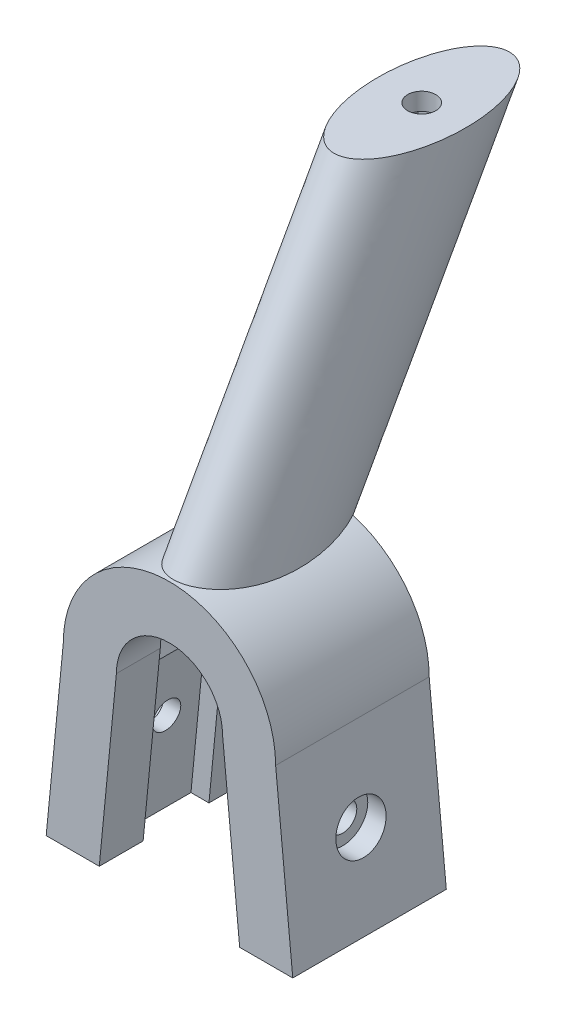
from build123d import *

# Parameters (mm, degrees)
BOSS_EXTRUDE1_DEPTH         = 3.75
BOLT_HOLE_REACH             = 26.729
SKETCH2_R                   = 1.6
BOLT_HOLE_DIRECTION_2_REACH = 26.729
BOSS_EXTRUDE2_START         = 5
BOSS_EXTRUDE2_DEPTH         = 5
CUT_EXTRUDE2_START          = 11
SKETCH4_R                   = 2.85
CUT_EXTRUDE2_DEPTH          = 3
SKETCH7_RX                  = 10
SKETCH7_RY                  = 5
SWEEP2_START                = 10.247926509
SWEEP2_DEPTH                = 2.568432868
SKETCH11_W                  = 7.251223943
SKETCH11_H                  = 3.177760732
CUT_EXTRUDE3_DEPTH          = 20
CUT_EXTRUDE5_START          = -2
CUT_EXTRUDE5_DEPTH          = 2.7
SKETCH13_R                  = 1.6
CUT_EXTRUDE6_DEPTH          = 2.7
CUT_EXTRUDE7_START          = -11
CUT_EXTRUDE7_DEPTH          = 10


# Read off the part's stored shape, not the designer's step: Sweep2
with BuildPart() as part:
    # Sketch1 → Boss-Extrude1 (new, symmetric)
    with BuildSketch(Plane.XY):
        with BuildLine():
            Line((-12.1, 0), (-14.051700625, -20))
            Line((-14.051700625, -20), (-10.051700625, -20))
            Line((-10.051700625, -20), (-8.425, -3.439385846))
            ThreePointArc((-8.425, -3.439385846), (0, 9.1), (8.425, -3.439385846))
            Line((8.425, -3.439385846), (10.051700625, -20))
            Line((10.051700625, -20), (14.051700625, -20))
            Line((14.051700625, -20), (12.1, 0))
            ThreePointArc((12.1, 0), (0, 12.1), (-12.1, 0))
        make_face()
    extrude(amount=BOSS_EXTRUDE1_DEPTH, both=True)

    # Bolt Hole: up to this plane
    bolt_hole_end = Plane(origin=(14.051700625, -20, 3.75), z_dir=(-0.995272319868323, -0.09712368044883128, 0))
    # Sketch2 → Bolt Hole (cut, up to the surface)
    with BuildSketch(Plane(origin=(0, 0, 0), x_dir=(0, 0, -1), z_dir=(1, 0, 0)), mode=Mode.PRIVATE) as bolt_hole_sk1:
        with Locations(Location((0, -10, 0), (0, 0, 90))):
            Circle(SKETCH2_R)
    bolt_hole_tool1 = split(extrude(bolt_hole_sk1.sketch, amount=BOLT_HOLE_REACH, mode=Mode.PRIVATE), bisect_by=bolt_hole_end, keep=Keep.BOTH, mode=Mode.PRIVATE)
    add(bolt_hole_tool1.solids().sort_by_distance((0, -10, 0))[0], mode=Mode.SUBTRACT)

    # Bolt Hole direction 2: up to this plane
    bolt_hole_direction_2_end = Plane(origin=(-12.1, 0, 3.75), z_dir=(0.995272319868323, -0.09712368044883138, 0))
    # Sketch2 → Bolt Hole direction 2 (cut, up to the surface)
    with BuildSketch(Plane(origin=(0, 0, 0), x_dir=(0, 0, -1), z_dir=(1, 0, 0)), mode=Mode.PRIVATE) as bolt_hole_direction_2_sk1:
        with Locations(Location((0, -10, 0), (0, 0, 90))):
            Circle(SKETCH2_R)
    bolt_hole_direction_2_tool1 = split(extrude(bolt_hole_direction_2_sk1.sketch, amount=-BOLT_HOLE_DIRECTION_2_REACH, mode=Mode.PRIVATE), bisect_by=bolt_hole_direction_2_end, keep=Keep.BOTH, mode=Mode.PRIVATE)
    add(bolt_hole_direction_2_tool1.solids().sort_by_distance((0, -10, 0))[0], mode=Mode.SUBTRACT)

    # Sketch3 → Boss-Extrude2 (add)
    with BuildSketch(Plane.XY.offset(3.75).offset(BOSS_EXTRUDE2_START)):
        with BuildLine():
            ThreePointArc((12.1, 0), (0, 12.1), (-12.1, 0))
            Line((-12.1, 0), (-6.05, 0))
            ThreePointArc((-6.05, 0), (0, 6.05), (6.05, 0))
            Line((6.05, 0), (12.1, 0))
        make_face()
        Polygon((-6.05, 0), (-12.1, 0), (-14.051700625, -20), (-8.001700625, -20), align=None)
        Polygon((14.051700625, -20), (12.1, 0), (6.05, 0), (8.001700625, -20), align=None)
    boss_extrude2 = extrude(amount=-BOSS_EXTRUDE2_DEPTH)

    # Sketch4 → Cut-Extrude2 (cut)
    with BuildSketch(Plane(origin=(0, 0, 0), x_dir=(0, 0, -1), z_dir=(1, 0, 0)).offset(CUT_EXTRUDE2_START)):
        with Locations(Location((0, -10, 0), (0, 0, 90))):
            Circle(SKETCH4_R)
    extrude(amount=CUT_EXTRUDE2_DEPTH, mode=Mode.SUBTRACT)

    # Sweep1: sweep along a path in Sketch8
    with BuildLine(Plane(origin=(0, 0, 0), x_dir=(0, 0, -1), z_dir=(1, 0, 0))) as sweep1_path:
        Line((20, 45), (0, 9.1))
    # Sketch7 → Sweep1 (sweep)
    with BuildSketch(Plane(origin=(0, 45, 0), x_dir=(1, 0, 0), z_dir=(0, 1, 0))):
        with Locations(Location((0, 20), (0, 0, -90))):
            Ellipse(SKETCH7_RX, SKETCH7_RY)
    sweep(path=sweep1_path.line)

    # Mirror2: Boss-Extrude2 across plane
    add(boss_extrude2.mirror(Plane.XY))

    # Sweep2 outline → Sweep2 (add)
    with BuildSketch(Plane(origin=(0, 0, 0), x_dir=(1, 0, 0), z_dir=(0, 0.8735827557825672, -0.48667562996243774)).offset(SWEEP2_START)):
        with BuildLine():
            add(Edge.make_bspline(
                [(-2.420614591, 3.21510088), (-4.140808386, 1.552228138), (-6.669000046, -3.159441487), (-5.965430129, -9.385769202), (-3.27241307, -12.380396445), (-1.32464484, -13.16457579), (1.32464484, -13.16457579), (3.27241307, -12.380396445), (5.965430129, -9.385769202), (6.669000046, -3.159441487), (4.140808386, 1.552228138), (1.714602002, 3.897587408), (0.891272318, 4.380182485), (0, 4.554319728), (-0.891272318, 4.380182485), (-1.714602002, 3.897587408), (-2.420614591, 3.21510088)],
                knots=[0.602606548, 0.602606548, 0.602606548, 0.602606548, 0.602606548, 0.602606548, 0.602606548, 1, 1, 1, 1, 1, 1.397393452, 1.397393452, 1.397393452, 1.397393452, 1.397393452, 1.560494133, 1.560494133, 1.560494133, 1.560494133, 1.560494133, 1.560494133, 1.560494133], degree=6, weights=[1, 1, 0.816743691, 0.81626183, 0.938272083, 1, 1, 0.938272083, 0.81626183, 0.816743691, 1, 1, 0.995833333, 0.99375, 0.995833333, 1, 1]))
        make_face()
    extrude(amount=SWEEP2_DEPTH)

    # Sketch11 → Cut-Extrude3 (cut)
    with BuildSketch(Plane(origin=(0, 0, 0), x_dir=(1, 0, 0), z_dir=(0, 1, 0))):
        with Locations((-0.008642554, -10.338880366)):
            Rectangle(SKETCH11_W, SKETCH11_H)
    extrude(amount=CUT_EXTRUDE3_DEPTH, mode=Mode.SUBTRACT)

    # Sketch12 → Cut-Extrude5 (cut)
    with BuildSketch(Plane(origin=(0, 45, 0), x_dir=(1, 0, 0), z_dir=(0, 1, 0)).offset(CUT_EXTRUDE5_START)):
        Polygon((-3.290892766, 20.010039827), (-3.290892766, 22.85), (3.290892766, 22.85), (3.290892766, 20.010039827), (1.642548134, 17.155023177), (-1.642548134, 17.155023177), align=None)
    extrude(amount=-CUT_EXTRUDE5_DEPTH, mode=Mode.SUBTRACT)

    # Sketch13 → Cut-Extrude6 (cut)
    with BuildSketch(Plane(origin=(0, 45, 0), x_dir=(1, 0, 0), z_dir=(0, 1, 0))):
        with Locations(Location((0, 20, 0), (0, 0, 270))):
            Circle(SKETCH13_R)
    extrude(amount=-CUT_EXTRUDE6_DEPTH, mode=Mode.SUBTRACT)

    # Sketch14 → Cut-Extrude7 (cut)
    with BuildSketch(Plane(origin=(0, 0, 0), x_dir=(0, 0, -1), z_dir=(1, 0, 0)).offset(CUT_EXTRUDE7_START)):
        Polygon((-3.233161507, -10), (-1.616580754, -12.8), (1.616580754, -12.8), (3.233161507, -10), (1.616580754, -7.2), (-1.616580754, -7.2), align=None)
    extrude(amount=-CUT_EXTRUDE7_DEPTH, mode=Mode.SUBTRACT)


solid = part.part
